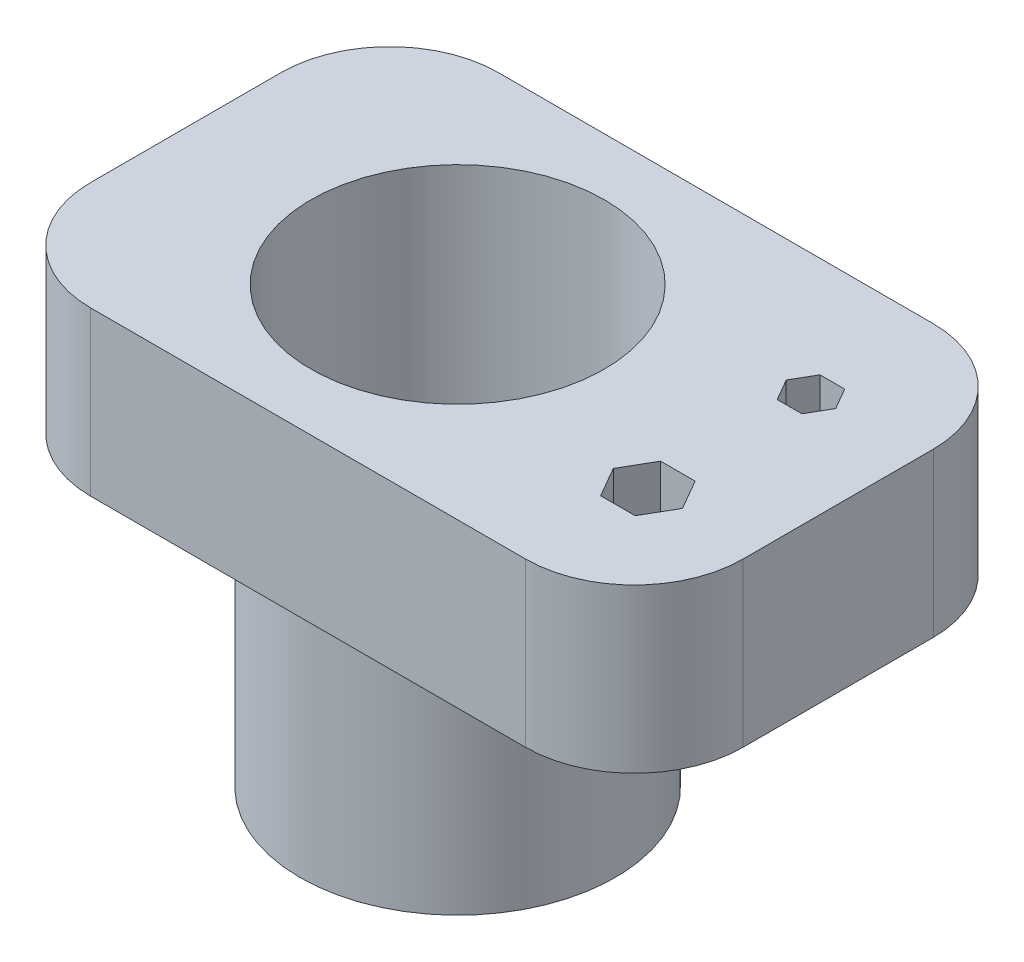
from build123d import *

# Parameters (mm, degrees)
SKETCH1_R           = 3.683
SKETCH1_R_2         = 3.4290000000000003
BOSS_EXTRUDE1_DEPTH = 6.35
FILLET1_R           = 2.54
BOSS_EXTRUDE2_DEPTH = 3.8099999999999996
SKETCH3_R           = 3.4290000000000003
CUT_EXTRUDE1_DEPTH  = 12.917885980743574
CUT_EXTRUDE2_DEPTH  = 3.8099999999999996
FILLET2_R           = 2.54


with BuildPart() as part:
    # Sketch1 → Boss-Extrude1 (new body)
    with BuildSketch(Plane(origin=(0, 0, 0), x_dir=(1, 0, 0), z_dir=(0, 1, 0))):
        with Locations(Location((0, 0, 0), (0, 0, 270))):
            Circle(SKETCH1_R)
        with Locations(Location((0, 0, 0), (0, 0, 270))):
            Circle(SKETCH1_R_2, mode=Mode.SUBTRACT)
    extrude(amount=BOSS_EXTRUDE1_DEPTH)

    # Fillet1
    # the kernel refuses this fillet: 2.54 mm, written as the material it takes off along each edge
    with BuildSketch(Plane(origin=(0, 0, 0), x_dir=(-1.8e-16, 0, 1), z_dir=(-1, 0, -1.8e-16))) as fillet1_piece_1:
        with BuildLine():
            CenterArc((5.968999999999999, 1.107160331659332), FILLET1_R, 180, 25.841932763167165)
            Line((3.683, 0), (3.6372799999999996, -0.02214320663318664))
            ThreePointArc((3.6372799999999996, -0.02214320663318664), (3.556, -0.0508), (3.4290000000000003, -0.0508))
            Line((3.4290000000000003, -0.0508), (3.3782, 0))
            Line((3.3782, 0), (3.378199999999999, 1.107160331659332))
            Line((3.378199999999999, 1.107160331659332), (3.4289999999999994, 1.107160331659332))
        make_face()
    revolve(axis=Axis((0, 0, 0), (0, 1, 0)), mode=Mode.SUBTRACT)

    # Sketch2 → Boss-Extrude2 (add)
    with BuildSketch(Plane(origin=(0, 6.35, 0), x_dir=(1, 0, 0), z_dir=(0, 1, 0))):
        Polygon((8.89, 4.762500000000003), (-6.349999999999998, 4.762499999999998), (-6.349999999999998, -4.762500000000002), (8.890000000000002, -4.7624999999999975), align=None)
    extrude(amount=BOSS_EXTRUDE2_DEPTH)

    # Sketch3 → Cut-Extrude1 (cut, through all)
    with BuildSketch(Plane.XZ.offset(-6.35)):
        with Locations(Location((0, 0, 0), (0, 0, 270))):
            Circle(SKETCH3_R)
    extrude(amount=-CUT_EXTRUDE1_DEPTH, mode=Mode.SUBTRACT)

    # Sketch4 → Cut-Extrude2 (cut)
    with BuildSketch(Plane(origin=(0, 10.159999999999998, 0), x_dir=(1, 0, 0), z_dir=(0, 1, 0))):
        Polygon((6.061324865405188, 1.4049999999999996), (6.638675134594815, 1.4049999999999996), (6.927350269189628, 1.9049999999999978), (6.638675134594814, 2.4049999999999994), (6.061324865405189, 2.4049999999999994), (5.772649730810376, 1.9049999999999991), align=None)
        Polygon((7.158290376865474, -1.9049999999999991), (6.754145188432737, -1.2050000000000012), (5.945854811567263, -1.2050000000000012), (5.541709623134526, -1.904999999999999), (5.945854811567265, -2.6049999999999995), (6.754145188432736, -2.6049999999999995), align=None)
    extrude(amount=-CUT_EXTRUDE2_DEPTH, mode=Mode.SUBTRACT)

    # Fillet2
    fillet2_edges = [part.edges().sort_by_distance(p)[0] for p in [
        (-6.349999999999998, 8.254999999999999, -4.762499999999998),
        (-6.349999999999998, 8.254999999999999, 4.762500000000002),
        (8.890000000000002, 8.254999999999999, 4.7624999999999975),
        (8.89, 8.254999999999999, -4.762500000000003),
    ]]
    fillet(fillet2_edges, radius=FILLET2_R)


solid = part.part
